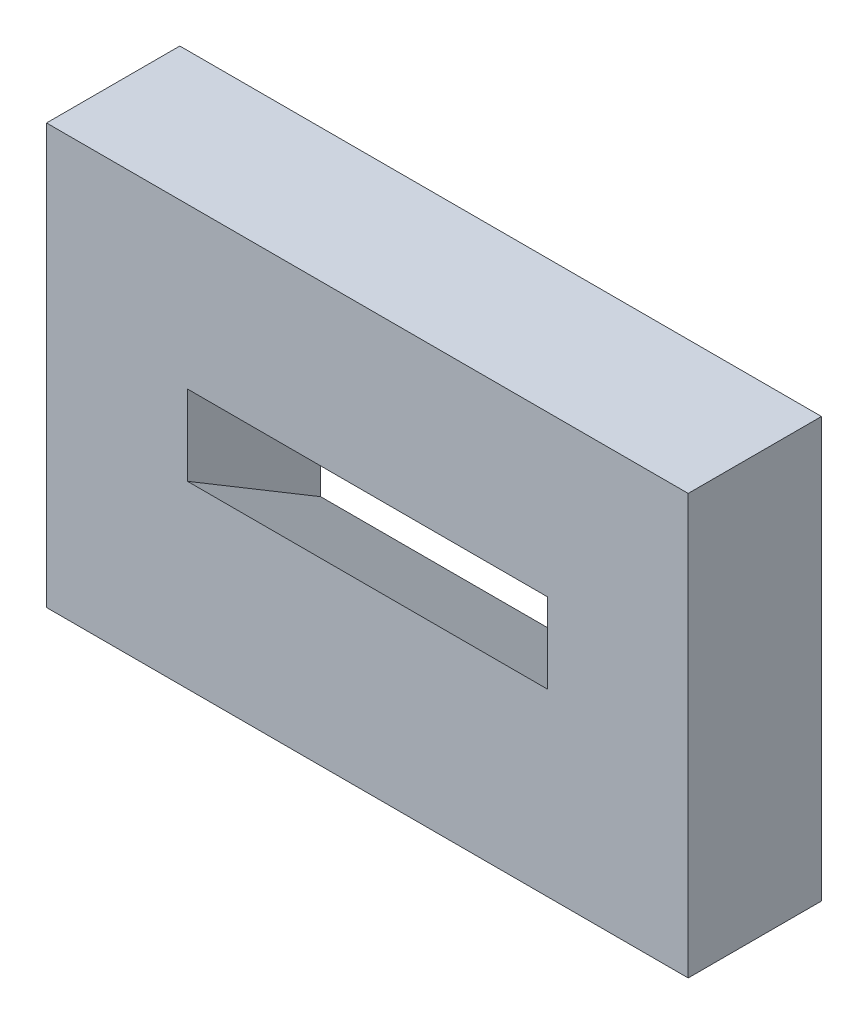
from build123d import *

# Parameters (mm, degrees)
SKIZZE1_W                                 = 110
SKIZZE1_H                                 = 170
AUFSATZ_LINEAR_AUSTRAGEN1_DEPTH           = 5
VERRUNDUNG1_R                             = 5
SCHNITT_LINEAR_AUSTRAGEN1_DEPTH           = 102.365674664
SKIZZE2_R                                 = 27
SCHNITT_LINEAR_AUSTRAGEN2_DEPTH           = 3
FASE1_SIZE                                = 3
SKIZZE4_R                                 = 4
AUFSATZ_LINEAR_AUSTRAGEN2_DEPTH           = 69
FASE2_SIZE                                = 1
LINEARES_MUSTER1_COUNT                    = 2
LINEARES_MUSTER1_PITCH                    = 134
LINEARES_MUSTER1_COUNT_DIR2               = 2
LINEARES_MUSTER1_PITCH_DIR2               = 98
FASE2_OF_LINEARES_MUSTER1_SIZE            = 1
VERRUNDUNG2_R                             = 1
GEWINDE1_PITCH                            = 1
GEWINDE2_PITCH                            = 1
GEWINDE3_PITCH                            = 1
GEWINDE4_PITCH                            = 1
SKIZZE10_W                                = 120
SKIZZE10_H                                = 150
SCHNITT_LINEAR_AUSTRAGEN4_DEPTH           = 2
SKIZZE12_R                                = 2
SCHNITT_LINEAR_AUSTRAGEN5_DEPTH           = 4.5
SKIZZE13_W                                = 11
SKIZZE13_H                                = 3
SKIZZE13_W_2                              = 3
SKIZZE13_H_2                              = 11
SKIZZE13_W_3                              = 13.5
SCHNITT_LINEAR_AUSTRAGEN6_DEPTH           = 125.233650894
SKIZZE14_R                                = 3
AUFSATZ_LINEAR_AUSTRAGEN3_DEPTH           = 4
SKIZZE15_R                                = 0.95
AUFSATZ_LINEAR_AUSTRAGEN4_DEPTH           = 4
AUFSATZ_LINEAR_AUSTRAGEN4_DRAFT           = 2
AUFSATZ_LINEAR_AUSTRAGEN4_PROFILE_2_DEPTH = 4
AUFSATZ_LINEAR_AUSTRAGEN4_PROFILE_2_DRAFT = 2
SKIZZE16_W                                = 123.691442011
SKIZZE16_H                                = 148.84203522
SCHNITT_LINEAR_AUSTRAGEN7_DEPTH           = 125.233650894
SKIZZE17_W                                = 11
SKIZZE17_H                                = 3
SCHNITT_LINEAR_AUSTRAGEN8_DEPTH           = 125.233650894
SCHNITT_LINEAR_AUSTRAGEN9_DEPTH           = 125.233650894
SCHNITT_LINEAR_AUSTRAGEN10_DEPTH          = 92.167499001
SCHNITT_LINEAR_AUSTRAGEN10_DEPTH_BACK     = 92.167499001
FASE3_SIZE2                               = 5
FASE3_SIZE                                = 3


with BuildPart() as part:
    # Skizze1 → Aufsatz-Linear austragen1 (new body)
    with BuildSketch(Plane.XY):
        Rectangle(SKIZZE1_W, SKIZZE1_H)
    extrude(amount=AUFSATZ_LINEAR_AUSTRAGEN1_DEPTH)

    # Verrundung1
    verrundung1_edges = [part.edges().sort_by_distance(p)[0] for p in [
        (55, -85, 2.5),
        (-55, -85, 2.5),
        (-55, 85, 2.5),
        (55, 85, 2.5),
    ]]
    fillet(verrundung1_edges, radius=VERRUNDUNG1_R)

    # Skizze3 → Schnitt-Linear austragen1 (cut, through all)
    with BuildSketch(Plane.XY.offset(5)):
        with BuildLine():
            Line((-35, 35), (-35, 17))
            ThreePointArc((-35, 17), (-27.513632984, 27.513632984), (-17, 35))
            Line((-17, 35), (-35, 35))
        make_face()
        with BuildLine():
            Line((35, 35), (17, 35))
            ThreePointArc((17, 35), (27.513632984, 27.513632984), (35, 17))
            Line((35, 17), (35, 35))
        make_face()
        with BuildLine():
            Line((35, -35), (35, -17))
            ThreePointArc((35, -17), (27.513632984, -27.513632984), (17, -35))
            Line((17, -35), (35, -35))
        make_face()
        with BuildLine():
            Line((-35, -35), (-17, -35))
            ThreePointArc((-17, -35), (-27.513632984, -27.513632984), (-35, -17))
            Line((-35, -17), (-35, -35))
        make_face()
    extrude(amount=-SCHNITT_LINEAR_AUSTRAGEN1_DEPTH, mode=Mode.SUBTRACT)

    # Skizze2 → Schnitt-Linear austragen2 (cut)
    with BuildSketch(Plane.XY.offset(5)):
        Circle(SKIZZE2_R)
    extrude(amount=-SCHNITT_LINEAR_AUSTRAGEN2_DEPTH, mode=Mode.SUBTRACT)

    # Fase1
    fase1_edges = [part.edges().sort_by_distance(p)[0] for p in [
        (-27, 0, 5),
    ]]
    chamfer(fase1_edges, length=FASE1_SIZE - 0.0001)  # a hair under: the kernel refuses the full size

    # Skizze4 → Aufsatz-Linear austragen2 (add)
    with BuildSketch(Plane(origin=(0, 0, 0), x_dir=(-1, 0, 0), z_dir=(0, 0, -1))):
        with Locations((-49, 67)):
            Circle(SKIZZE4_R)
    aufsatz_linear_austragen2 = extrude(amount=AUFSATZ_LINEAR_AUSTRAGEN2_DEPTH)

    # Fase2
    fase2_edges = [part.edges().sort_by_distance(p)[0] for p in [
        (53, 67, 0),
    ]]
    chamfer(fase2_edges, length=FASE2_SIZE)

    # Lineares Muster1: Aufsatz-Linear austragen2 2 × 2
    with Locations(*[(-j * LINEARES_MUSTER1_PITCH_DIR2, -i * LINEARES_MUSTER1_PITCH, 0) for i in range(LINEARES_MUSTER1_COUNT) for j in range(LINEARES_MUSTER1_COUNT_DIR2) if (i, j) != (0, 0)]):
        add(aufsatz_linear_austragen2)

    # Fase2 of Lineares Muster1
    fase2_of_lineares_muster1_edges = [part.edges().sort_by_distance(p)[0] for p in [
        (-45, 67, 0),
        (53, -67, 0),
        (-45, -67, 0),
    ]]
    chamfer(fase2_of_lineares_muster1_edges, length=FASE2_OF_LINEARES_MUSTER1_SIZE)

    # Verrundung2
    verrundung2_edges = [part.edges().sort_by_distance(p)[0] for p in [
        (-35, -35, 2.5),
        (-35, -17, 2.5),
        (-17, -35, 2.5),
        (35, -35, 2.5),
        (17, -35, 2.5),
        (35, -17, 2.5),
        (35, 35, 2.5),
        (35, 17, 2.5),
        (17, 35, 2.5),
        (-35, 35, 2.5),
        (-17, 35, 2.5),
        (-35, 17, 2.5),
    ]]
    fillet(verrundung2_edges, radius=VERRUNDUNG2_R)

    # Gewinde1: the profile of Gewindeprofil1 profile screwed along a right-hand helix of 12 turns, 8 arcs to a turn; built about Z, then put on its axis
    gewinde1_z = Axis((0, 0, 0), (0, 0, 1))
    gewinde1_corners = [(4.0003, 0, -0.000173205), (4.0003, 0, 0.875173202), (3.458734125, 0, 0.562499999), (3.458734125, 0, 0.312499999)]
    with BuildLine(mode=Mode.PRIVATE) as gewinde1_profile:
        Line(gewinde1_corners[0], gewinde1_corners[1])
        Line(gewinde1_corners[1], gewinde1_corners[2])
        Line(gewinde1_corners[2], gewinde1_corners[3])
        Line(gewinde1_corners[3], gewinde1_corners[0])
    gewinde1_cap = Face(gewinde1_profile.wire())
    gewinde1_turn_angles = [0, 22.5, 45, 67.5, 90, 112.5, 135, 157.5, 180, 202.5, 225, 247.5, 270, 292.5, 315, 337.5, 360]
    gewinde1_turn_weights = [1, 0.9238795325112867, 1, 0.9238795325112867, 1, 0.9238795325112867, 1, 0.9238795325112867, 1, 0.9238795325112867, 1, 0.9238795325112867, 1, 0.9238795325112867, 1, 0.9238795325112867, 1]
    gewinde1_turn_rails = [Edge.make_bspline([Vector(p[0], p[1], 0).rotate(gewinde1_z, gewinde1_turn_angles[k]) / gewinde1_turn_weights[k] + Vector(0, 0, p[2] + GEWINDE1_PITCH * gewinde1_turn_angles[k] / 360) for k in range(17)], [0, 0, 0, 1, 1, 2, 2, 3, 3, 4, 4, 5, 5, 6, 6, 7, 7, 8, 8, 8], 2, gewinde1_turn_weights) for p in gewinde1_corners]
    gewinde1_turn_sides = [Face.make_surface_from_curves(gewinde1_turn_rails[p[0]], gewinde1_turn_rails[p[1]]) for p in [(0, 1), (1, 2), (2, 3), (3, 0)]]
    gewinde1 = Plane(origin=(49, 67, -69), x_dir=(1, 0, 0), z_dir=(0, 0, 1)) * Solid(Shell([*[p.moved(Location((0, 0, GEWINDE1_PITCH * i))) for i in range(12) for p in gewinde1_turn_sides], gewinde1_cap, gewinde1_cap.rotate(gewinde1_z, 4320).moved(Location((0, 0, GEWINDE1_PITCH * 4320 / 360)))]))
    add(gewinde1, mode=Mode.SUBTRACT)

    # Gewinde2: the profile of Gewindeprofil2 profile screwed along a right-hand helix of 12 turns, 8 arcs to a turn; built about Z, then put on its axis
    gewinde2_z = Axis((0, 0, 0), (0, 0, 1))
    gewinde2_corners = [(4.0003, 0, -0.000173205), (4.0003, 0, 0.875173202), (3.458734125, 0, 0.562499999), (3.458734125, 0, 0.312499999)]
    with BuildLine(mode=Mode.PRIVATE) as gewinde2_profile:
        Line(gewinde2_corners[0], gewinde2_corners[1])
        Line(gewinde2_corners[1], gewinde2_corners[2])
        Line(gewinde2_corners[2], gewinde2_corners[3])
        Line(gewinde2_corners[3], gewinde2_corners[0])
    gewinde2_cap = Face(gewinde2_profile.wire())
    gewinde2_turn_angles = [0, 22.5, 45, 67.5, 90, 112.5, 135, 157.5, 180, 202.5, 225, 247.5, 270, 292.5, 315, 337.5, 360]
    gewinde2_turn_weights = [1, 0.9238795325112867, 1, 0.9238795325112867, 1, 0.9238795325112867, 1, 0.9238795325112867, 1, 0.9238795325112867, 1, 0.9238795325112867, 1, 0.9238795325112867, 1, 0.9238795325112867, 1]
    gewinde2_turn_rails = [Edge.make_bspline([Vector(p[0], p[1], 0).rotate(gewinde2_z, gewinde2_turn_angles[k]) / gewinde2_turn_weights[k] + Vector(0, 0, p[2] + GEWINDE2_PITCH * gewinde2_turn_angles[k] / 360) for k in range(17)], [0, 0, 0, 1, 1, 2, 2, 3, 3, 4, 4, 5, 5, 6, 6, 7, 7, 8, 8, 8], 2, gewinde2_turn_weights) for p in gewinde2_corners]
    gewinde2_turn_sides = [Face.make_surface_from_curves(gewinde2_turn_rails[p[0]], gewinde2_turn_rails[p[1]]) for p in [(0, 1), (1, 2), (2, 3), (3, 0)]]
    gewinde2 = Plane(origin=(49, -67, -69), x_dir=(1, 0, 0), z_dir=(0, 0, 1)) * Solid(Shell([*[p.moved(Location((0, 0, GEWINDE2_PITCH * i))) for i in range(12) for p in gewinde2_turn_sides], gewinde2_cap, gewinde2_cap.rotate(gewinde2_z, 4320).moved(Location((0, 0, GEWINDE2_PITCH * 4320 / 360)))]))
    add(gewinde2, mode=Mode.SUBTRACT)

    # Gewinde3: the profile of Gewindeprofil3 profile screwed along a right-hand helix of 12 turns, 8 arcs to a turn; built about Z, then put on its axis
    gewinde3_z = Axis((0, 0, 0), (0, 0, 1))
    gewinde3_corners = [(4.0003, 0, -0.000173205), (4.0003, 0, 0.875173202), (3.458734125, 0, 0.562499999), (3.458734125, 0, 0.312499999)]
    with BuildLine(mode=Mode.PRIVATE) as gewinde3_profile:
        Line(gewinde3_corners[0], gewinde3_corners[1])
        Line(gewinde3_corners[1], gewinde3_corners[2])
        Line(gewinde3_corners[2], gewinde3_corners[3])
        Line(gewinde3_corners[3], gewinde3_corners[0])
    gewinde3_cap = Face(gewinde3_profile.wire())
    gewinde3_turn_angles = [0, 22.5, 45, 67.5, 90, 112.5, 135, 157.5, 180, 202.5, 225, 247.5, 270, 292.5, 315, 337.5, 360]
    gewinde3_turn_weights = [1, 0.9238795325112867, 1, 0.9238795325112867, 1, 0.9238795325112867, 1, 0.9238795325112867, 1, 0.9238795325112867, 1, 0.9238795325112867, 1, 0.9238795325112867, 1, 0.9238795325112867, 1]
    gewinde3_turn_rails = [Edge.make_bspline([Vector(p[0], p[1], 0).rotate(gewinde3_z, gewinde3_turn_angles[k]) / gewinde3_turn_weights[k] + Vector(0, 0, p[2] + GEWINDE3_PITCH * gewinde3_turn_angles[k] / 360) for k in range(17)], [0, 0, 0, 1, 1, 2, 2, 3, 3, 4, 4, 5, 5, 6, 6, 7, 7, 8, 8, 8], 2, gewinde3_turn_weights) for p in gewinde3_corners]
    gewinde3_turn_sides = [Face.make_surface_from_curves(gewinde3_turn_rails[p[0]], gewinde3_turn_rails[p[1]]) for p in [(0, 1), (1, 2), (2, 3), (3, 0)]]
    gewinde3 = Plane(origin=(-49, -67, -69), x_dir=(1, 0, 0), z_dir=(0, 0, 1)) * Solid(Shell([*[p.moved(Location((0, 0, GEWINDE3_PITCH * i))) for i in range(12) for p in gewinde3_turn_sides], gewinde3_cap, gewinde3_cap.rotate(gewinde3_z, 4320).moved(Location((0, 0, GEWINDE3_PITCH * 4320 / 360)))]))
    add(gewinde3, mode=Mode.SUBTRACT)

    # Gewinde4: the profile of Gewindeprofil4 profile screwed along a right-hand helix of 12 turns, 8 arcs to a turn; built about Z, then put on its axis
    gewinde4_z = Axis((0, 0, 0), (0, 0, 1))
    gewinde4_corners = [(4.0003, 0, -0.000173205), (4.0003, 0, 0.875173202), (3.458734125, 0, 0.562499999), (3.458734125, 0, 0.312499999)]
    with BuildLine(mode=Mode.PRIVATE) as gewinde4_profile:
        Line(gewinde4_corners[0], gewinde4_corners[1])
        Line(gewinde4_corners[1], gewinde4_corners[2])
        Line(gewinde4_corners[2], gewinde4_corners[3])
        Line(gewinde4_corners[3], gewinde4_corners[0])
    gewinde4_cap = Face(gewinde4_profile.wire())
    gewinde4_turn_angles = [0, 22.5, 45, 67.5, 90, 112.5, 135, 157.5, 180, 202.5, 225, 247.5, 270, 292.5, 315, 337.5, 360]
    gewinde4_turn_weights = [1, 0.9238795325112867, 1, 0.9238795325112867, 1, 0.9238795325112867, 1, 0.9238795325112867, 1, 0.9238795325112867, 1, 0.9238795325112867, 1, 0.9238795325112867, 1, 0.9238795325112867, 1]
    gewinde4_turn_rails = [Edge.make_bspline([Vector(p[0], p[1], 0).rotate(gewinde4_z, gewinde4_turn_angles[k]) / gewinde4_turn_weights[k] + Vector(0, 0, p[2] + GEWINDE4_PITCH * gewinde4_turn_angles[k] / 360) for k in range(17)], [0, 0, 0, 1, 1, 2, 2, 3, 3, 4, 4, 5, 5, 6, 6, 7, 7, 8, 8, 8], 2, gewinde4_turn_weights) for p in gewinde4_corners]
    gewinde4_turn_sides = [Face.make_surface_from_curves(gewinde4_turn_rails[p[0]], gewinde4_turn_rails[p[1]]) for p in [(0, 1), (1, 2), (2, 3), (3, 0)]]
    gewinde4 = Plane(origin=(-49, 67, -69), x_dir=(1, 0, 0), z_dir=(0, 0, 1)) * Solid(Shell([*[p.moved(Location((0, 0, GEWINDE4_PITCH * i))) for i in range(12) for p in gewinde4_turn_sides], gewinde4_cap, gewinde4_cap.rotate(gewinde4_z, 4320).moved(Location((0, 0, GEWINDE4_PITCH * 4320 / 360)))]))
    add(gewinde4, mode=Mode.SUBTRACT)

    # Skizze10 → Schnitt-Linear austragen4 (cut)
    with BuildSketch(Plane(origin=(0, 0, -69), x_dir=(-1, 0, 0), z_dir=(0, 0, -1))):
        Rectangle(SKIZZE10_W, SKIZZE10_H)
    extrude(amount=-SCHNITT_LINEAR_AUSTRAGEN4_DEPTH, mode=Mode.SUBTRACT)

    # Skizze12 → Schnitt-Linear austragen5 (cut)
    with BuildSketch(Plane(origin=(0, 0, 0), x_dir=(-1, 0, 0), z_dir=(0, 0, -1))):
        with Locations((49, 59.5)):
            Circle(SKIZZE12_R)
        with Locations(Location((-49, 59.5, 0), (0, 0, 180))):
            Circle(SKIZZE12_R)
        with Locations((-49, -59.5)):
            Circle(SKIZZE12_R)
        with Locations(Location((49, -59.5, 0), (0, 0, 180))):
            Circle(SKIZZE12_R)
    extrude(amount=-SCHNITT_LINEAR_AUSTRAGEN5_DEPTH, mode=Mode.SUBTRACT)

    # Skizze13 → Schnitt-Linear austragen6 (cut, through all)
    with BuildSketch(Plane.XY.offset(5)):
        with Locations((0, -75.5)):
            Rectangle(SKIZZE13_W, SKIZZE13_H)
        with Locations((45.5, 0)):
            Rectangle(SKIZZE13_W_2, SKIZZE13_H_2)
        with Locations((-45.5, 0)):
            Rectangle(SKIZZE13_W_2, SKIZZE13_H_2)
        with Locations((0, 77.5)):
            Rectangle(SKIZZE13_W_3, SKIZZE13_H)
    extrude(amount=-SCHNITT_LINEAR_AUSTRAGEN6_DEPTH, mode=Mode.SUBTRACT)

    # Skizze14 → Aufsatz-Linear austragen3 (add)
    with BuildSketch(Plane.XY.offset(5)):
        with Locations(Location((6, 65, 0), (0, 0, 180))):
            Circle(SKIZZE14_R)
        with Locations(Location((-6, 65, 0), (0, 0, 180))):
            Circle(SKIZZE14_R)
    extrude(amount=AUFSATZ_LINEAR_AUSTRAGEN3_DEPTH)


with BuildPart() as aufsatz_linear_austragen4_tool:
    # Skizze15 → Aufsatz-Linear austragen4 (with draft: the straight prism first)
    with BuildSketch(Plane.XY.offset(9)):
        with Locations((-6, 65)):
            Circle(SKIZZE15_R)
    extrude(amount=AUFSATZ_LINEAR_AUSTRAGEN4_DEPTH)
    # Aufsatz-Linear austragen4: the draft: its side faces are tilted about the plane it starts from
    aufsatz_linear_austragen4_sides = [aufsatz_linear_austragen4_tool.faces().sort_by_distance(p)[0] for p in [
        (-6.95, 65, 11),
    ]]
    draft(aufsatz_linear_austragen4_sides, Plane.XY.offset(9), AUFSATZ_LINEAR_AUSTRAGEN4_DRAFT)


with BuildPart() as part_1:
    add(part.part)

    # Aufsatz-Linear austragen4: add aufsatz_linear_austragen4_tool
    add(aufsatz_linear_austragen4_tool.part)


with BuildPart() as aufsatz_linear_austragen4_profile_2_tool:
    # Skizze15 → Aufsatz-Linear austragen4 profile 2 (with draft: the straight prism first)
    with BuildSketch(Plane.XY.offset(9)):
        with Locations((6, 65)):
            Circle(SKIZZE15_R)
    extrude(amount=AUFSATZ_LINEAR_AUSTRAGEN4_PROFILE_2_DEPTH)
    # Aufsatz-Linear austragen4 profile 2: the draft: its side faces are tilted about the plane it starts from
    aufsatz_linear_austragen4_profile_2_sides = [aufsatz_linear_austragen4_profile_2_tool.faces().sort_by_distance(p)[0] for p in [
        (5.05, 65, 11),
    ]]
    draft(aufsatz_linear_austragen4_profile_2_sides, Plane.XY.offset(9), AUFSATZ_LINEAR_AUSTRAGEN4_PROFILE_2_DRAFT)


with BuildPart() as part_2:
    add(part_1.part)

    # Aufsatz-Linear austragen4 profile 2: add aufsatz_linear_austragen4_profile_2_tool
    add(aufsatz_linear_austragen4_profile_2_tool.part)

    # Skizze16 → Schnitt-Linear austragen7 (cut, through all)
    with BuildSketch(Plane.XY.offset(5)):
        with Locations((1.053547931, -15.254497888)):
            Rectangle(SKIZZE16_W, SKIZZE16_H)
    extrude(amount=-SCHNITT_LINEAR_AUSTRAGEN7_DEPTH, mode=Mode.SUBTRACT)

    # Skizze17 → Schnitt-Linear austragen8 (cut, through all)
    with BuildSketch(Plane.XY.offset(5)):
        with Locations((-25, 77.5)):
            Rectangle(SKIZZE17_W, SKIZZE17_H)
        with Locations((25, 77.5)):
            Rectangle(SKIZZE17_W, SKIZZE17_H)
    extrude(amount=-SCHNITT_LINEAR_AUSTRAGEN8_DEPTH, mode=Mode.SUBTRACT)

    # Skizze18 → Schnitt-Linear austragen9 (cut, through all)
    with BuildSketch(Plane.XY.offset(5)):
        Polygon((-56.129703441, 86.036343512), (-31.976755215, 86.036343512), (-31.976755215, 69.255661459), (-12.036530516, 69.255661459), (-12.036530516, 52.474979407), (-31.976755215, 52.474979407), (-56.129703441, 52.474979407), align=None)
        Polygon((56.129703441, 86.036343512), (56.129703441, 52.474979407), (31.976755215, 52.474979407), (12.036530516, 52.474979407), (12.036530516, 69.255661459), (31.976755215, 69.255661459), (31.976755215, 86.036343512), align=None)
    extrude(amount=-SCHNITT_LINEAR_AUSTRAGEN9_DEPTH, mode=Mode.SUBTRACT)

    # Skizze19 → Schnitt-Linear austragen10 (cut, two sides: drawn at the far end of the back side and taken through both)
    with BuildSketch(Plane.XY.offset(5).offset(-SCHNITT_LINEAR_AUSTRAGEN10_DEPTH_BACK)):
        Polygon((-36.863489822, 88.674968535), (-12.036530516, 88.674968535), (-12.036530516, 69.255661459), (12.036530516, 69.255661459), (12.036530516, 91.604966771), (35.434216654, 91.604966771), (35.434216654, 59.166519722), (12.036530516, 59.166519722), (-12.036530516, 59.166519722), (-36.863489822, 59.166519722), align=None)
    extrude(amount=SCHNITT_LINEAR_AUSTRAGEN10_DEPTH + SCHNITT_LINEAR_AUSTRAGEN10_DEPTH_BACK, mode=Mode.SUBTRACT)

    # Fase3
    fase3_edges = [part_2.edges().sort_by_distance(p)[0] for p in [
        (0, 76, 0),
    ]]
    fase3_side = [part_2.faces().sort_by_distance(p)[0] for p in [
        (0, 75.94, 0),
    ]]
    chamfer(fase3_edges, length=FASE3_SIZE - 0.0001, length2=FASE3_SIZE2 - 0.0001, reference=fase3_side[0])  # a hair under: the kernel refuses the full size


solid = part_2.part
